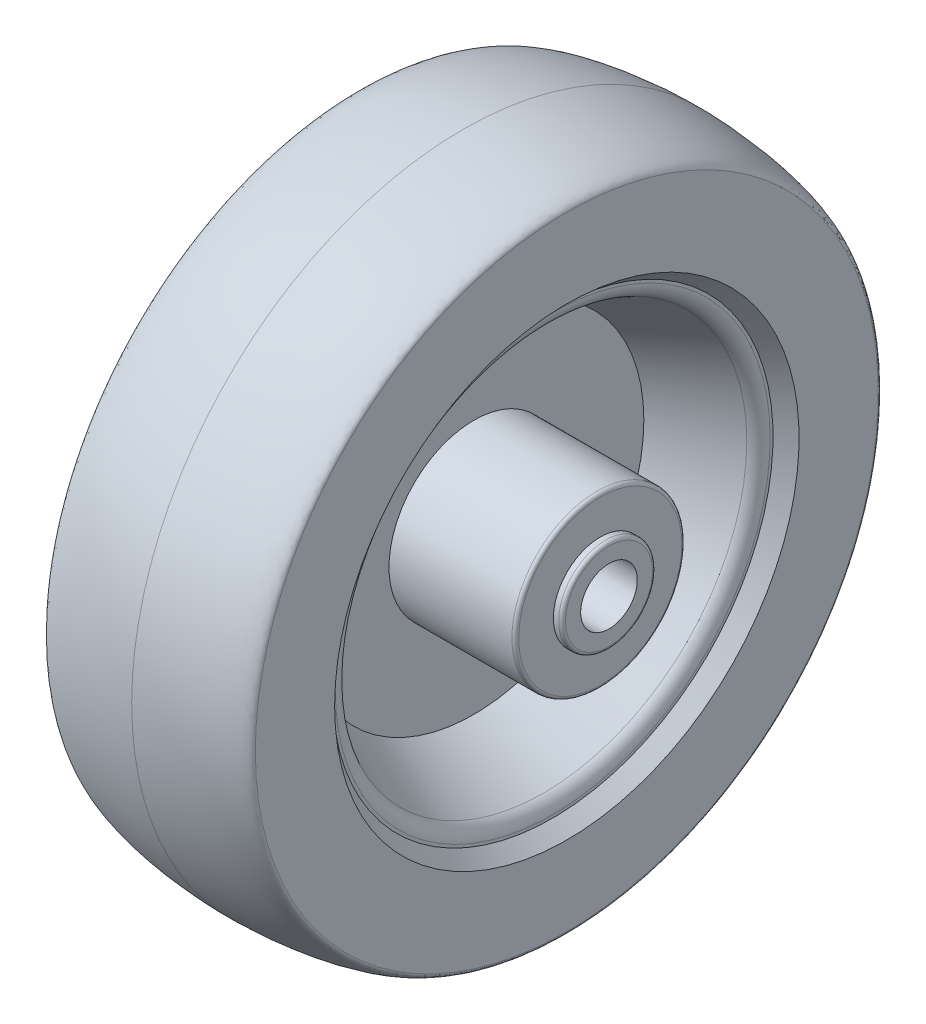
from build123d import *

# Parameters (mm, degrees)
SKETCH8_R            = 19.05
BOSS_EXTRUDE1_DEPTH  = 28.321
SKETCH9_R            = 10.5156
BOSS_EXTRUDE2_DEPTH  = 1.9558
FILLET4_R            = 0.762
FILLET4_OF_MIRROR2_R = 0.762
SKETCH10_R           = 6.35
CUT_EXTRUDE5_DEPTH   = 124.78996661


with BuildPart() as part:
    # Sketch5 → Revolve1 (revolve)
    with BuildSketch(Plane.XY):
        with BuildLine():
            Line((-23.2791, 0), (-23.2791, 69.85))
            add(Edge.make_bspline(
                [(-23.2791, 69.85), (-23.2791, 72.067965362), (-10.536247667, 74.295), (0, 74.295)],
                knots=[0, 0, 0, 0, 1, 1, 1, 1], degree=3))
            add(Edge.make_bspline(
                [(23.2791, 69.85), (23.2791, 72.067965362), (10.536247667, 74.295), (0, 74.295)],
                knots=[0, 0, 0, 0, 1, 1, 1, 1], degree=3))
            Line((23.2791, 69.85), (23.2791, 0))
            Line((23.2791, 0), (-23.2791, 0))
        make_face()
    revolve(axis=Axis((-23.2791, 0, 0), (1, 0, 0)))

    # Sketch7 → Cut-Revolve2 (revolve, cut)
    with BuildSketch(Plane(origin=(0, 0, 0), x_dir=(1, 0, 0), z_dir=(0, 1, 0))):
        with BuildLine():
            Line((2.4511, 0), (2.4511, 38.1))
            Line((2.4511, 38.1), (18.078907112, 45.553541634))
            ThreePointArc((18.078907112, 45.553541634), (19.555481427, 46.865602451), (20.1041, 48.763177998))
            Line((20.1041, 48.763177998), (20.1041, 49.412815204))
            Line((20.1041, 49.412815204), (23.2791, 52.07))
            Line((23.2791, 52.07), (23.2791, 0))
            Line((23.2791, 0), (2.4511, 0))
        make_face()
    cut_revolve2 = revolve(axis=Axis((-1000, 0, 0), (1, 0, 0)), mode=Mode.SUBTRACT)

    # Mirror1: Cut-Revolve2 across plane
    add(cut_revolve2.mirror(Plane(origin=(0, 0, 0), x_dir=(0, 0, 1), z_dir=(1, 0, 0))), mode=Mode.SUBTRACT)

    # Sketch8 → Boss-Extrude1 (add)
    with BuildSketch(Plane(origin=(2.4511, 0, 0), x_dir=(0, 0, -1), z_dir=(1, 0, 0))):
        Circle(SKETCH8_R)
    boss_extrude1 = extrude(amount=BOSS_EXTRUDE1_DEPTH)

    # Sketch9 → Boss-Extrude2 (add)
    with BuildSketch(Plane(origin=(30.7721, 0, 0), x_dir=(0, 0, -1), z_dir=(1, 0, 0))):
        Circle(SKETCH9_R)
    boss_extrude2 = extrude(amount=BOSS_EXTRUDE2_DEPTH)

    # Fillet4
    fillet4_edges = [part.edges().sort_by_distance(p)[0] for p in [
        (32.7279, 0, 10.5156),
        (30.7721, 0, 19.05),
    ]]
    fillet(fillet4_edges, radius=FILLET4_R)

    # Mirror2: Boss-Extrude1, Boss-Extrude2 across plane
    add(boss_extrude1.mirror(Plane(origin=(0, 0, 0), x_dir=(0, 0, 1), z_dir=(1, 0, 0))))
    add(boss_extrude2.mirror(Plane(origin=(0, 0, 0), x_dir=(0, 0, 1), z_dir=(1, 0, 0))))

    # Fillet4 of Mirror2
    fillet4_of_mirror2_edges = [part.edges().sort_by_distance(p)[0] for p in [
        (-32.7279, 0, 10.5156),
        (-30.7721, 0, 19.05),
    ]]
    fillet(fillet4_of_mirror2_edges, radius=FILLET4_OF_MIRROR2_R)

    # Sketch10 → Cut-Extrude5 (cut, through all)
    with BuildSketch(Plane.ZY.offset(32.7279)):
        Circle(SKETCH10_R)
    extrude(amount=-CUT_EXTRUDE5_DEPTH, mode=Mode.SUBTRACT)


solid = part.part
